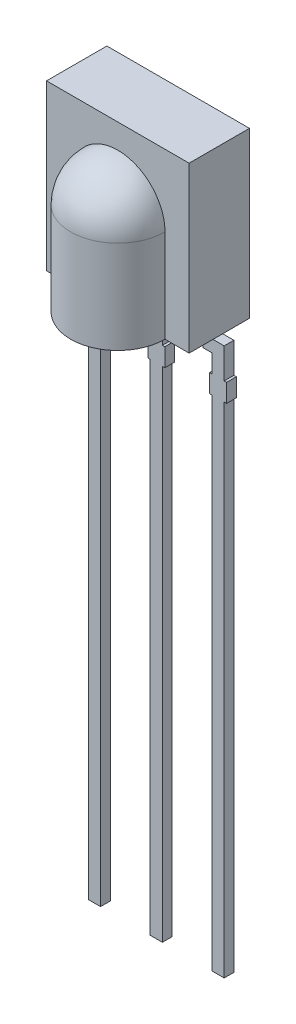
from build123d import *

# Parameters (mm, degrees)
IZIM2_W                     = 2.48
IZIM2_H                     = 6.762592592
Y_KSEKLIK_EKSTR_ZYON2_DEPTH = 5.86
Y_KSEKLIK_EKSTR_ZYON3_DEPTH = 0.4


# Read off the part's stored shape, not the designer's step: Döndür1
with BuildPart() as part:
    # Çizim2 → Yükseklik-Ekstrüzyon2 (new body)
    with BuildSketch(Plane(origin=(0, 0, 0), x_dir=(0, 0, -1), z_dir=(1, 0, 0))):
        Rectangle(IZIM2_W, IZIM2_H)
    extrude(amount=-Y_KSEKLIK_EKSTR_ZYON2_DEPTH)

    # Döndür1 outline → Döndür1 (revolve)
    with BuildSketch(Plane(origin=(-2.93, 0, 1.24), x_dir=(1, 0, 0), z_dir=(0, 0, 1))):
        with BuildLine():
            Line((0, 2.378703704), (0, -3.381296296))
            Line((0, -3.381296296), (1.94, -3.381296296))
            Line((1.94, -3.381296296), (1.94, 0.438703704))
            ThreePointArc((1.94, 0.438703704), (1.371787155, 1.810490859), (0, 2.378703704))
        make_face()
    revolve(axis=Axis((-2.93, 0, 1.24), (0, 1, 0)))

    # Çizim6 → Yükseklik-Ekstrüzyon3 (add)
    with BuildSketch(Plane(origin=(0, 0, -0.74), x_dir=(-1, 0, 0), z_dir=(0, 0, -1))):
        with BuildLine():
            Line((2.43, -3.381296296), (2.43, -4.381296296))
            ThreePointArc((2.43, -4.381296296), (2.459289322, -4.452006974), (2.53, -4.481296296))
            Line((2.53, -4.481296296), (2.68, -4.481296296))
            Line((2.68, -4.481296296), (2.68, -5.231296296))
            Line((2.68, -5.231296296), (2.58, -5.231296296))
            Line((2.58, -5.231296296), (2.58, -5.981296296))
            Line((2.58, -5.981296296), (2.68, -5.981296296))
            Line((2.68, -5.981296296), (2.68, -26.481296296))
            Line((2.68, -26.481296296), (3.18, -26.481296296))
            Line((3.18, -26.481296296), (3.18, -5.981296296))
            Line((3.18, -5.981296296), (3.28, -5.981296296))
            Line((3.28, -5.981296296), (3.28, -5.231296296))
            Line((3.28, -5.231296296), (3.18, -5.231296296))
            Line((3.18, -5.231296296), (3.18, -4.481296296))
            Line((3.18, -4.481296296), (3.33, -4.481296296))
            ThreePointArc((3.33, -4.481296296), (3.400710678, -4.452006974), (3.43, -4.381296296))
            Line((3.43, -4.381296296), (3.43, -3.381296296))
            Line((3.43, -3.381296296), (2.43, -3.381296296))
        make_face()
        Polygon((5.22, -4.481296296), (5.22, -5.231296296), (5.12, -5.231296296), (5.12, -5.981296296), (5.22, -5.981296296), (5.22, -26.481296296), (5.72, -26.481296296), (5.72, -5.981296296), (5.82, -5.981296296), (5.82, -5.231296296), (5.72, -5.231296296), (5.72, -4.481296296), (5.72, -3.981296296), (5.22, -3.981296296), (5.22, -3.381296296), (4.86, -3.381296296), (4.86, -4.481296296), align=None)
        Polygon((0.14, -4.481296296), (0.14, -5.231296296), (0.04, -5.231296296), (0.04, -5.981296296), (0.14, -5.981296296), (0.14, -26.481296296), (0.64, -26.481296296), (0.64, -5.981296296), (0.74, -5.981296296), (0.74, -5.231296296), (0.64, -5.231296296), (0.64, -4.481296296), (1, -4.481296296), (1, -3.381296296), (0.64, -3.381296296), (0.64, -3.981296296), (0.14, -3.981296296), align=None)
    extrude(amount=-Y_KSEKLIK_EKSTR_ZYON3_DEPTH)


solid = part.part
